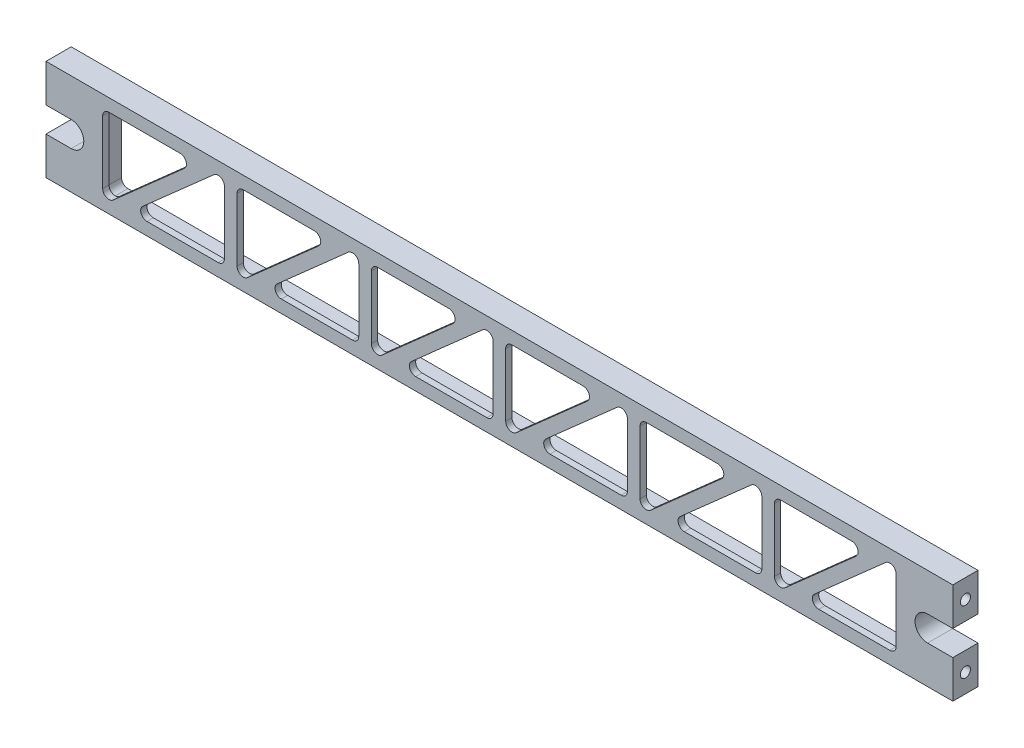
from build123d import *

# Parameters (mm, degrees)
SKETCH1_W                             = 12.7
SKETCH1_H                             = 50.8
BOSS_EXTRUDE1_DEPTH                   = 228.6
F_1_4_20_TAPPED_HOLE1_D               = 5.1054
F_1_4_20_TAPPED_HOLE1_DEPTH           = 19.05
F_1_4_20_TAPPED_HOLE1_TIP             = 1.533816902
F_1_4_20_TAPPED_HOLE1_ON_FACE_2_D     = 5.1054
F_1_4_20_TAPPED_HOLE1_ON_FACE_2_DEPTH = 19.05
F_1_4_20_TAPPED_HOLE1_ON_FACE_2_TIP   = 1.533816902
CUT_EXTRUDE1_DEPTH                    = 9.525
CUT_EXTRUDE2_DEPTH                    = 235.370061281
CUT_EXTRUDE3_DEPTH                    = 235.52055347


with BuildPart() as part:
    # Sketch1 → Boss-Extrude1 (new, symmetric)
    with BuildSketch(Plane(origin=(0, 0, 0), x_dir=(0, 0, -1), z_dir=(1, 0, 0))):
        with Locations((6.35, 25.4)):
            Rectangle(SKETCH1_W, SKETCH1_H)
    extrude(amount=BOSS_EXTRUDE1_DEPTH, both=True)

    # 1/4-20 Tapped Hole1
    with Locations(Plane(origin=(228.6, 41.275, -6.35), x_dir=(0, 0, 1), z_dir=(1, 0, 0))):
        with Locations((0, 0), (0, 31.75)):
            Hole(F_1_4_20_TAPPED_HOLE1_D / 2, depth=F_1_4_20_TAPPED_HOLE1_DEPTH)
            with Locations((0, 0, -(F_1_4_20_TAPPED_HOLE1_DEPTH + F_1_4_20_TAPPED_HOLE1_TIP / 2))):  # 118° drill point
                Cone(0, F_1_4_20_TAPPED_HOLE1_D / 2, F_1_4_20_TAPPED_HOLE1_TIP, mode=Mode.SUBTRACT)

    # 1/4-20 Tapped Hole1 on face 2
    with Locations(Plane(origin=(-228.6, 9.525, -6.35), x_dir=(0, 0, -1), z_dir=(-1, 0, 0))):
        with Locations((0, 0), (0, -31.75)):
            Hole(F_1_4_20_TAPPED_HOLE1_ON_FACE_2_D / 2, depth=F_1_4_20_TAPPED_HOLE1_ON_FACE_2_DEPTH)
            with Locations((0, 0, -(F_1_4_20_TAPPED_HOLE1_ON_FACE_2_DEPTH + F_1_4_20_TAPPED_HOLE1_ON_FACE_2_TIP / 2))):  # 118° drill point
                Cone(0, F_1_4_20_TAPPED_HOLE1_ON_FACE_2_D / 2, F_1_4_20_TAPPED_HOLE1_ON_FACE_2_TIP, mode=Mode.SUBTRACT)

    # Sketch4 → Cut-Extrude1 (cut)
    with BuildSketch(Plane(origin=(0, 0, -12.7), x_dir=(-1, 0, 0), z_dir=(0, 0, -1))):
        with BuildLine():
            Line((200.025, 47.625), (-200.025, 47.625))
            ThreePointArc((-200.025, 47.625), (-202.27006403, 46.69506403), (-203.2, 44.45))
            Line((-203.2, 44.45), (-203.2, 6.35))
            ThreePointArc((-203.2, 6.35), (-202.27006403, 4.10493597), (-200.025, 3.175))
            Line((-200.025, 3.175), (200.025, 3.175))
            ThreePointArc((200.025, 3.175), (202.27006403, 4.10493597), (203.2, 6.35))
            Line((203.2, 6.35), (203.2, 44.45))
            ThreePointArc((203.2, 44.45), (202.27006403, 46.69506403), (200.025, 47.625))
        make_face()
    extrude(amount=-CUT_EXTRUDE1_DEPTH, mode=Mode.SUBTRACT)

    # Sketch5 → Cut-Extrude2 (cut, through all)
    with BuildSketch(Plane(origin=(0, 0, -3.175), x_dir=(-1, 0, 0), z_dir=(0, 0, -1))):
        with BuildLine():
            Line((-200.025, 41.275), (-200.025, 9.525))
            ThreePointArc((-200.025, 9.525), (-199.09506403, 7.27993597), (-196.85, 6.35))
            Line((-196.85, 6.35), (-160.978429025, 6.35))
            ThreePointArc((-160.978429025, 6.35), (-158.009493592, 8.399812285), (-158.874107969, 11.90248983))
            Line((-158.874107969, 11.90248983), (-194.745678944, 43.65248983))
            ThreePointArc((-194.745678944, 43.65248983), (-198.153726514, 44.169982241), (-200.025, 41.275))
        make_face()
        with BuildLine():
            Line((-179.792558698, 38.89751017), (-143.920987723, 7.14751017))
            ThreePointArc((-143.920987723, 7.14751017), (-140.512940153, 6.630017759), (-138.641666667, 9.525))
            Line((-138.641666667, 9.525), (-138.641666667, 41.275))
            ThreePointArc((-138.641666667, 41.275), (-139.571602636, 43.52006403), (-141.816666667, 44.45))
            Line((-141.816666667, 44.45), (-177.688237642, 44.45))
            ThreePointArc((-177.688237642, 44.45), (-180.657173075, 42.400187715), (-179.792558698, 38.89751017))
        make_face()
        with BuildLine():
            Line((-132.291666667, 41.275), (-132.291666667, 9.525))
            ThreePointArc((-132.291666667, 9.525), (-131.361730697, 7.27993597), (-129.116666667, 6.35))
            Line((-129.116666667, 6.35), (-93.245095692, 6.35))
            ThreePointArc((-93.245095692, 6.35), (-90.276160259, 8.399812285), (-91.140774636, 11.90248983))
            Line((-91.140774636, 11.90248983), (-127.012345611, 43.65248983))
            ThreePointArc((-127.012345611, 43.65248983), (-130.420393181, 44.169982241), (-132.291666667, 41.275))
        make_face()
        with BuildLine():
            Line((-112.059225364, 38.89751017), (-76.187654389, 7.14751017))
            ThreePointArc((-76.187654389, 7.14751017), (-72.779606819, 6.630017759), (-70.908333333, 9.525))
            Line((-70.908333333, 9.525), (-70.908333333, 41.275))
            ThreePointArc((-70.908333333, 41.275), (-71.838269303, 43.52006403), (-74.083333333, 44.45))
            Line((-74.083333333, 44.45), (-109.954904308, 44.45))
            ThreePointArc((-109.954904308, 44.45), (-112.923839741, 42.400187715), (-112.059225364, 38.89751017))
        make_face()
        with BuildLine():
            Line((-64.558333333, 41.275), (-64.558333333, 9.525))
            ThreePointArc((-64.558333333, 9.525), (-63.628397364, 7.27993597), (-61.383333333, 6.35))
            Line((-61.383333333, 6.35), (-25.511762358, 6.35))
            ThreePointArc((-25.511762358, 6.35), (-22.542826925, 8.399812285), (-23.407441302, 11.90248983))
            Line((-23.407441302, 11.90248983), (-59.279012277, 43.65248983))
            ThreePointArc((-59.279012277, 43.65248983), (-62.687059847, 44.169982241), (-64.558333333, 41.275))
        make_face()
        with BuildLine():
            Line((-44.325892031, 38.89751017), (-8.454321056, 7.14751017))
            ThreePointArc((-8.454321056, 7.14751017), (-5.046273486, 6.630017759), (-3.175, 9.525))
            Line((-3.175, 9.525), (-3.175, 41.275))
            ThreePointArc((-3.175, 41.275), (-4.10493597, 43.52006403), (-6.35, 44.45))
            Line((-6.35, 44.45), (-42.221570975, 44.45))
            ThreePointArc((-42.221570975, 44.45), (-45.190506408, 42.400187715), (-44.325892031, 38.89751017))
        make_face()
        with BuildLine():
            Line((3.175, 41.275), (3.175, 9.525))
            ThreePointArc((3.175, 9.525), (4.10493597, 7.27993597), (6.35, 6.35))
            Line((6.35, 6.35), (42.221570975, 6.35))
            ThreePointArc((42.221570975, 6.35), (45.190506408, 8.399812285), (44.325892031, 11.90248983))
            Line((44.325892031, 11.90248983), (8.454321056, 43.65248983))
            ThreePointArc((8.454321056, 43.65248983), (5.046273486, 44.169982241), (3.175, 41.275))
        make_face()
        with BuildLine():
            Line((23.407441302, 38.89751017), (59.279012277, 7.14751017))
            ThreePointArc((59.279012277, 7.14751017), (62.687059847, 6.630017759), (64.558333333, 9.525))
            Line((64.558333333, 9.525), (64.558333333, 41.275))
            ThreePointArc((64.558333333, 41.275), (63.628397364, 43.52006403), (61.383333333, 44.45))
            Line((61.383333333, 44.45), (25.511762358, 44.45))
            ThreePointArc((25.511762358, 44.45), (22.542826925, 42.400187715), (23.407441302, 38.89751017))
        make_face()
        with BuildLine():
            Line((70.908333333, 41.275), (70.908333333, 9.525))
            ThreePointArc((70.908333333, 9.525), (71.838269303, 7.27993597), (74.083333333, 6.35))
            Line((74.083333333, 6.35), (109.954904308, 6.35))
            ThreePointArc((109.954904308, 6.35), (112.923839741, 8.399812285), (112.059225364, 11.90248983))
            Line((112.059225364, 11.90248983), (76.187654389, 43.65248983))
            ThreePointArc((76.187654389, 43.65248983), (72.779606819, 44.169982241), (70.908333333, 41.275))
        make_face()
        with BuildLine():
            Line((91.140774636, 38.89751017), (127.012345611, 7.14751017))
            ThreePointArc((127.012345611, 7.14751017), (130.420393181, 6.630017759), (132.291666667, 9.525))
            Line((132.291666667, 9.525), (132.291666667, 41.275))
            ThreePointArc((132.291666667, 41.275), (131.361730697, 43.52006403), (129.116666667, 44.45))
            Line((129.116666667, 44.45), (93.245095692, 44.45))
            ThreePointArc((93.245095692, 44.45), (90.276160259, 42.400187715), (91.140774636, 38.89751017))
        make_face()
        with BuildLine():
            Line((138.641666667, 41.275), (138.641666667, 9.525))
            ThreePointArc((138.641666667, 9.525), (139.571602636, 7.27993597), (141.816666667, 6.35))
            Line((141.816666667, 6.35), (177.688237642, 6.35))
            ThreePointArc((177.688237642, 6.35), (180.657173075, 8.399812285), (179.792558698, 11.90248983))
            Line((179.792558698, 11.90248983), (143.920987723, 43.65248983))
            ThreePointArc((143.920987723, 43.65248983), (140.512940153, 44.169982241), (138.641666667, 41.275))
        make_face()
        with BuildLine():
            Line((158.874107969, 38.89751017), (194.745678944, 7.14751017))
            ThreePointArc((194.745678944, 7.14751017), (198.153726514, 6.630017759), (200.025, 9.525))
            Line((200.025, 9.525), (200.025, 41.275))
            ThreePointArc((200.025, 41.275), (199.09506403, 43.52006403), (196.85, 44.45))
            Line((196.85, 44.45), (160.978429025, 44.45))
            ThreePointArc((160.978429025, 44.45), (158.009493592, 42.400187715), (158.874107969, 38.89751017))
        make_face()
    extrude(amount=-CUT_EXTRUDE2_DEPTH, mode=Mode.SUBTRACT)

    # Sketch6 → Cut-Extrude3 (cut, through all)
    with BuildSketch(Plane.XY):
        with BuildLine():
            Line((-215.9, 31.75), (-228.6, 31.75))
            Line((-228.6, 31.75), (-228.6, 19.05))
            Line((-228.6, 19.05), (-215.9, 19.05))
            ThreePointArc((-215.9, 19.05), (-209.55, 25.4), (-215.9, 31.75))
        make_face()
        with BuildLine():
            Line((228.6, 19.05), (215.9, 19.05))
            ThreePointArc((215.9, 19.05), (209.55, 25.4), (215.9, 31.75))
            Line((215.9, 31.75), (228.6, 31.75))
            Line((228.6, 31.75), (228.6, 19.05))
        make_face()
    extrude(amount=-CUT_EXTRUDE3_DEPTH, mode=Mode.SUBTRACT)


solid = part.part
